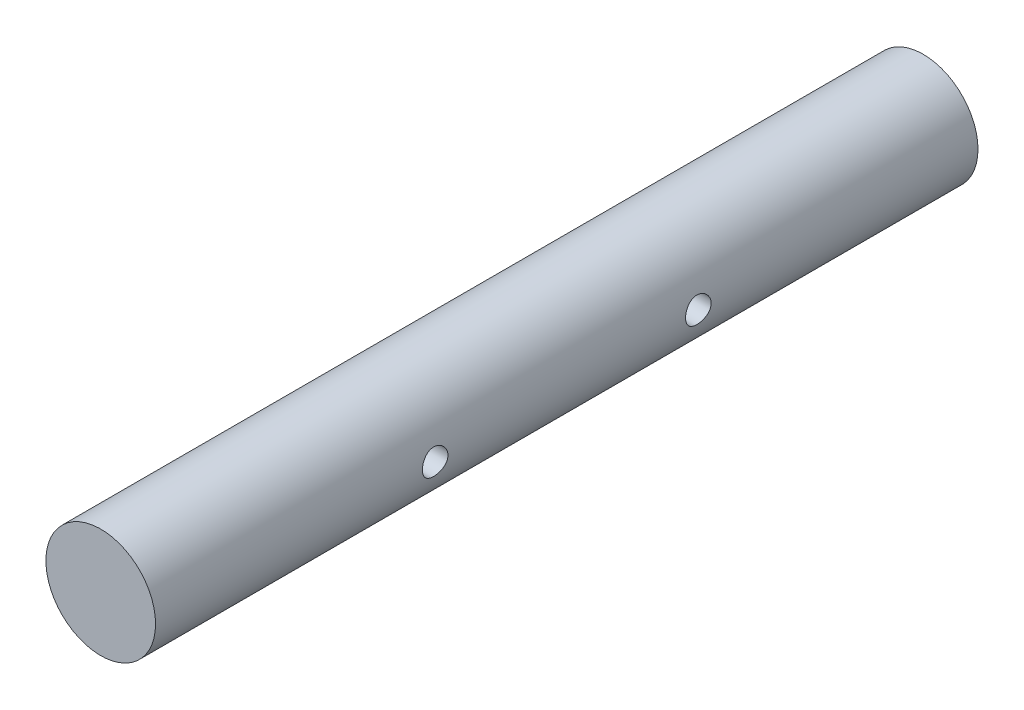
from build123d import *

# Parameters (mm, degrees)
SKETCH1_R               = 30
BOSS_EXTRUDE1_DEPTH     = 225
CUT_EXTRUDE1_DEPTH      = 229.965062837
CUT_EXTRUDE1_DEPTH_BACK = 229.965062837
SKETCH2_R               = 7


with BuildPart() as part:
    # Sketch1 → Boss-Extrude1 (new, symmetric)
    with BuildSketch(Plane.XY):
        Circle(SKETCH1_R)
    extrude(amount=BOSS_EXTRUDE1_DEPTH, both=True)

    # Sketch2 → Cut-Extrude1 (cut, two sides: drawn at the far end of the back side and taken through both)
    with BuildSketch(Plane(origin=(0, 0, 0), x_dir=(0, 0, -1), z_dir=(1, 0, 0)).offset(-CUT_EXTRUDE1_DEPTH_BACK)):
        with Locations((72, 0)):
            Circle(SKETCH2_R)
        with Locations((-72, 0)):
            Circle(SKETCH2_R)
    extrude(amount=CUT_EXTRUDE1_DEPTH + CUT_EXTRUDE1_DEPTH_BACK, mode=Mode.SUBTRACT)


solid = part.part
